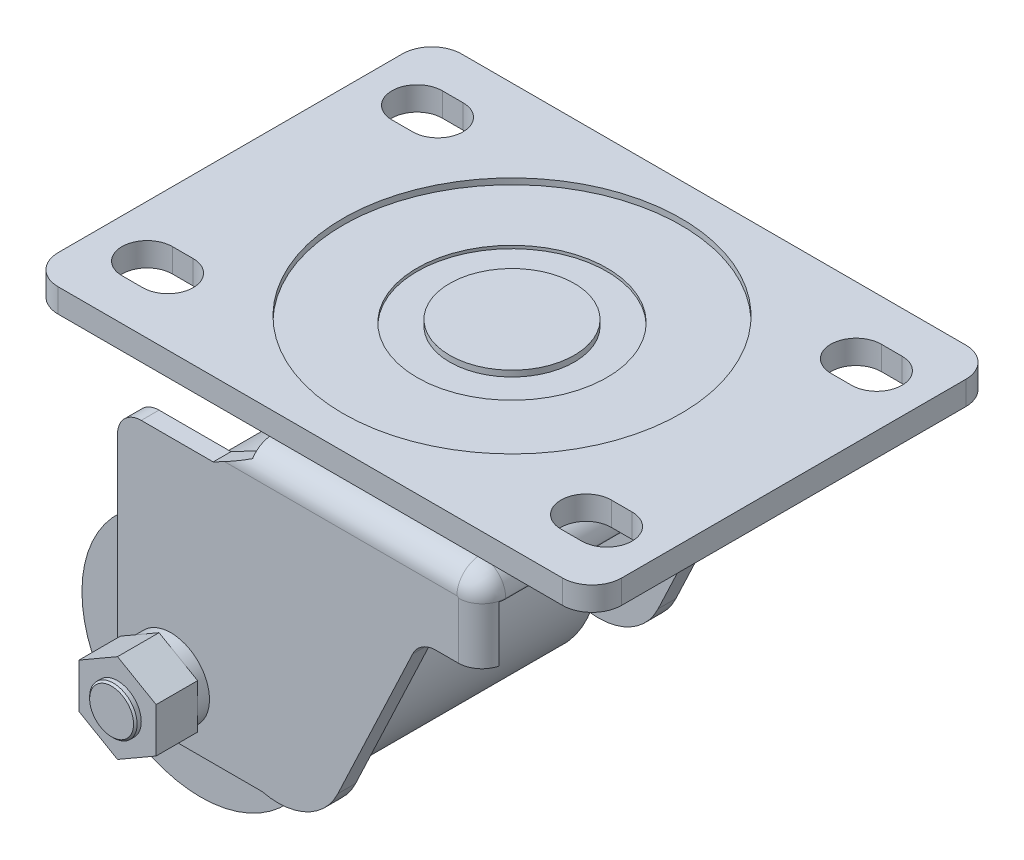
from build123d import *

# Parameters (mm, degrees)
SKETCH_1_W               = 95
SKETCH_1_H               = 68
EXTRUDE_1_DEPTH          = 4
CUT_EXTRUDE_1_DEPTH      = 20
FILLET_3_R               = 4
EXTRUDE_2_DEPTH          = 28.5
CUT_EXTRUDE_2_DEPTH      = 112.133432069
CUT_EXTRUDE_2_DEPTH_BACK = 112.133432069
SKETCH_5_W               = 51
SKETCH_5_H               = 45
FILLET_1_R               = 5
SKETCH_6_R               = 20
EXTRUDE_3_DEPTH          = 23.5
SKETCH_7_R               = 11.95
EXTRUDE_4_DEPTH          = 25
EXTRUDE_5_DEPTH          = 6
SKETCH_9_R               = 6.5
EXTRUDE_6_DEPTH          = 2
EXTRUDE_7_DEPTH          = 7
SKETCH_11_R              = 4
EXTRUDE_8_DEPTH          = 1
CHAMFER_1_SIZE           = 0.3
FILLET_4_R               = 4
SKETCH_12_R              = 28.5
CUT_EXTRUDE_3_DEPTH      = 1
SKETCH_13_R              = 16
CUT_EXTRUDE_4_DEPTH      = 0.5
SKETCH_14_R              = 10.5
EXTRUDE_9_DEPTH          = 1
FILLET_5_R               = 4


with BuildPart() as part:
    # 草图1 → 凸台-拉伸1 (new body)
    with BuildSketch(Plane(origin=(0, 0, 0), x_dir=(1, 0, 0), z_dir=(0, 1, 0))):
        Rectangle(SKETCH_1_W, SKETCH_1_H)
    extrude(amount=-EXTRUDE_1_DEPTH)

    # 草图2 → 切除-拉伸1 (cut)
    with BuildSketch(Plane(origin=(0, 0, 0), x_dir=(1, 0, 0), z_dir=(0, 1, 0))):
        with BuildLine():
            Line((-38.75, 27), (-35.25, 27))
            ThreePointArc((-35.25, 27), (-31, 22.75), (-35.25, 18.5))
            Line((-35.25, 18.5), (-38.75, 18.5))
            ThreePointArc((-38.75, 18.5), (-43, 22.75), (-38.75, 27))
        make_face()
        with BuildLine():
            Line((38.75, 27), (35.25, 27))
            ThreePointArc((35.25, 27), (31, 22.75), (35.25, 18.5))
            Line((35.25, 18.5), (38.75, 18.5))
            ThreePointArc((38.75, 18.5), (43, 22.75), (38.75, 27))
        make_face()
        with BuildLine():
            Line((-38.75, -27), (-35.25, -27))
            ThreePointArc((-35.25, -27), (-31, -22.75), (-35.25, -18.5))
            Line((-35.25, -18.5), (-38.75, -18.5))
            ThreePointArc((-38.75, -18.5), (-43, -22.75), (-38.75, -27))
        make_face()
        with BuildLine():
            Line((38.75, -27), (35.25, -27))
            ThreePointArc((35.25, -27), (31, -22.75), (35.25, -18.5))
            Line((35.25, -18.5), (38.75, -18.5))
            ThreePointArc((38.75, -18.5), (43, -22.75), (38.75, -27))
        make_face()
    extrude(amount=-CUT_EXTRUDE_1_DEPTH, mode=Mode.SUBTRACT)

    # 草图3 → 旋转1 (revolve)
    with BuildSketch(Plane.XY, mode=Mode.PRIVATE) as revolve_1_sk:
        Polygon((0, -4), (0, -13), (26, -13), (26, -6), (21.6, -6), (21.6, -4), align=None)
    revolve(revolve_1_sk.sketch.rotate(Axis((0, -4, 0), (0, -1, 0)), 180), axis=Axis((0, -4, 0), (0, -1, 0)))

    # 圆角3
    fillet_3_edges = [part.edges().sort_by_distance(p)[0] for p in [
        (26, -13, 0),
    ]]
    fillet(fillet_3_edges, radius=FILLET_3_R)

    # 草图4 → 凸台-拉伸2 (add, symmetric)
    with BuildSketch(Plane.XY):
        with BuildLine():
            Line((0, -13), (19.213266574, -13))
            ThreePointArc((19.213266574, -13), (22.207827325, -14.240387677), (23.448215001, -17.234948428))
            Line((23.448215001, -17.234948428), (23.448215001, -26.714524519))
            Line((23.448215001, -26.714524519), (15.690154109, -26.714524519))
            ThreePointArc((15.690154109, -26.714524519), (13.363781565, -27.389556753), (11.760049066, -29.204968498))
            Line((11.760049066, -29.204968498), (-0.86355109, -55.938832562))
            ThreePointArc((-0.86355109, -55.938832562), (-6.156003064, -61.245269428), (-13.61245677, -62))
            Line((-13.61245677, -62), (-29, -62))
            ThreePointArc((-29, -62), (-35.363961031, -59.363961031), (-38, -53))
            Line((-38, -53), (-38, -18))
            Line((-38, -18), (-21.869158005, -18))
            Line((-21.869158005, -18), (-15.86908091, -14.84239498))
            Line((-15.86908091, -14.84239498), (-15.86908091, -13))
            Line((-15.86908091, -13), (0, -13))
        make_face()
    extrude(amount=EXTRUDE_2_DEPTH, both=True)

    # 草图5 → 切除-拉伸2 (cut, two sides: drawn at the far end of the back side and taken through both)
    with BuildSketch(Plane.ZY.offset(38).offset(-CUT_EXTRUDE_2_DEPTH_BACK)):
        with Locations((0, -39.824872431)):
            Rectangle(SKETCH_5_W, SKETCH_5_H)
    extrude(amount=CUT_EXTRUDE_2_DEPTH + CUT_EXTRUDE_2_DEPTH_BACK, mode=Mode.SUBTRACT)

    # 圆角1
    fillet_1_edges = [part.edges().sort_by_distance(p)[0] for p in [
        (47.5, -2, 34),
        (-47.5, -2, 34),
        (-47.5, -2, -34),
        (47.5, -2, -34),
    ]]
    fillet(fillet_1_edges, radius=FILLET_1_R)

    # 草图8 → 凸台-拉伸5 (add)
    with BuildSketch(Plane(origin=(0, 0, -28.5), x_dir=(-1, 0, 0), z_dir=(0, 0, -1))):
        Polygon((29, -45.494446501), (22.5, -49.24722325), (22.5, -56.75277675), (29, -60.505553499), (35.5, -56.75277675), (35.5, -49.24722325), align=None)
    extrude(amount=EXTRUDE_5_DEPTH)

    # 草图9 → 凸台-拉伸6 (add)
    with BuildSketch(Plane.XY.offset(28.5)):
        with Locations(Location((-29, -53, 0), (0, 0, 180))):
            Circle(SKETCH_9_R)
    extrude(amount=EXTRUDE_6_DEPTH)

    # 草图10 → 凸台-拉伸7 (add)
    with BuildSketch(Plane.XY.offset(30.5)):
        Polygon((-29, -45.494446501), (-35.5, -49.24722325), (-35.5, -56.75277675), (-29, -60.505553499), (-22.5, -56.75277675), (-22.5, -49.24722325), align=None)
    extrude(amount=EXTRUDE_7_DEPTH)

    # 草图11 → 凸台-拉伸8 (add)
    with BuildSketch(Plane.XY.offset(37.5)):
        with Locations((-29, -53)):
            Circle(SKETCH_11_R)
    extrude(amount=EXTRUDE_8_DEPTH)

    # 倒角1
    chamfer_1_edges = [part.edges().sort_by_distance(p)[0] for p in [
        (-33, -53, 38.5),
    ]]
    chamfer(chamfer_1_edges, length=CHAMFER_1_SIZE)

    # 圆角4
    # the kernel refuses this fillet: 4 mm, written as the material it takes off along each edge
    with BuildSketch(Plane(origin=(-38, -18, -15.5), x_dir=(1, 0, 0), z_dir=(0, 0, -1))) as fillet_4_piece_1:
        with BuildLine():
            CenterArc((FILLET_4_R, FILLET_4_R), FILLET_4_R, 180, 90)
            Line((0, FILLET_4_R), (0, 0))
            Line((0, 0), (FILLET_4_R, 0))
        make_face()
    extrude(amount=23, mode=Mode.SUBTRACT)
    with BuildSketch(Plane(origin=(-20.586281446, -17.324872431, 25.5), x_dir=(0.8849382990030265, 0.46570828525765995, 0), z_dir=(0, 0, -1))) as fillet_4_piece_2:
        with BuildLine():
            CenterArc((9.312388245, 0.380655196), FILLET_4_R, 117.756070689, 67.704676822)
            Line((7.449555104, 3.920408392), (0, 0))
            Line((0, 0), (5.330541736, 0))
        make_face()
    extrude(amount=51, mode=Mode.SUBTRACT)
    with BuildSketch(Plane(origin=(-38, -18, 38.5), x_dir=(0, -1, 0), z_dir=(0, 0, -1))) as fillet_4_piece_3:
        with BuildLine():
            CenterArc((FILLET_4_R, -FILLET_4_R), FILLET_4_R, 90, 90)
            Line((0, -FILLET_4_R), (0, 0))
            Line((0, 0), (FILLET_4_R, 0))
        make_face()
    extrude(amount=23, mode=Mode.SUBTRACT)

    # 草图12 → 切除-拉伸3 (cut)
    with BuildSketch(Plane(origin=(0, 0, 0), x_dir=(1, 0, 0), z_dir=(0, 1, 0))):
        with Locations(Location((0, 0, 0), (0, 0, 270))):
            Circle(SKETCH_12_R)
    extrude(amount=-CUT_EXTRUDE_3_DEPTH, mode=Mode.SUBTRACT)

    # 草图13 → 切除-拉伸4 (cut)
    with BuildSketch(Plane(origin=(0, -1, 0), x_dir=(1, 0, 0), z_dir=(0, 1, 0))):
        with Locations(Location((0, 0, 0), (0, 0, 270))):
            Circle(SKETCH_13_R)
    extrude(amount=-CUT_EXTRUDE_4_DEPTH, mode=Mode.SUBTRACT)

    # 草图14 → 凸台-拉伸9 (add)
    with BuildSketch(Plane(origin=(0, -1.5, 0), x_dir=(1, 0, 0), z_dir=(0, 1, 0))):
        with Locations(Location((0, 0, 0), (0, 0, 270))):
            Circle(SKETCH_14_R)
    extrude(amount=EXTRUDE_9_DEPTH)

    # 圆角5
    fillet_5_edges = [part.edges().sort_by_distance(p)[0] for p in [
        (23.448215001, -21.974736473, -28.5),
        (22.207827325, -14.240387677, -28.5),
        (23.448215001, -21.974736473, 28.5),
        (22.207827325, -14.240387677, 28.5),
        (1.672092832, -13, -28.5),
        (1.672092832, -13, 28.5),
    ]]
    fillet(fillet_5_edges, radius=FILLET_5_R)


with BuildPart() as body_2:
    # 草图6 → 凸台-拉伸3 (new, symmetric)
    with BuildSketch(Plane.XY):
        with Locations((-29, -53)):
            Circle(SKETCH_6_R)
    extrude(amount=EXTRUDE_3_DEPTH, both=True)

    # 草图7 → 凸台-拉伸4 (add, symmetric)
    with BuildSketch(Plane.XY):
        with Locations((-29, -53)):
            Circle(SKETCH_7_R)
    extrude(amount=EXTRUDE_4_DEPTH, both=True)


solid = Compound([part.part, body_2.part])
